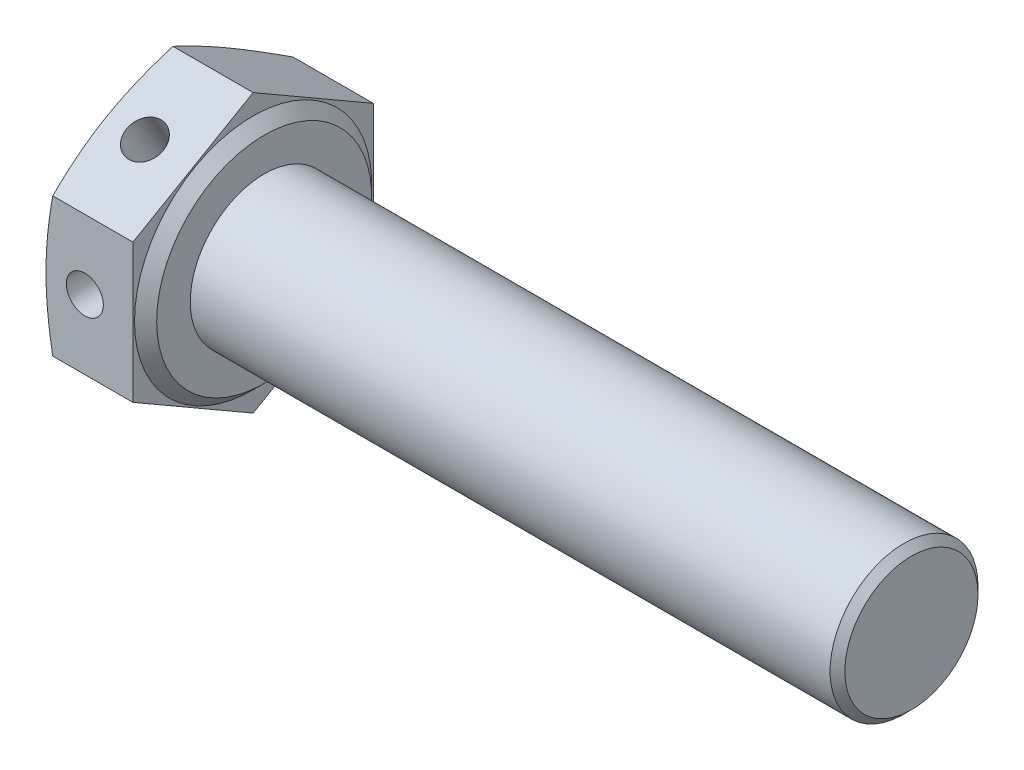
from build123d import *

# Parameters (mm, degrees)
BASEHEAD_DEPTH    = 5.3
SKETCH5_R         = 4
BASEBODY_DEPTH    = 35
CHAMFER1_SIZE     = 0.4
SKETCH6_R         = 1
HOLE_DEPTH        = 42.505100088
CIRPATTERN1_COUNT = 2
CIRPATTERN1_ANGLE = 60


with BuildPart() as part:
    # Sketch2 → BaseHead (new body)
    with BuildSketch(Plane(origin=(0, 0, 0), x_dir=(0, 0, -1), z_dir=(1, 0, 0))):
        Polygon((0, -7.505553499), (6.5, -3.75277675), (6.5, 3.75277675), (0, 7.505553499), (-6.5, 3.75277675), (-6.5, -3.75277675), align=None)
    extrude(amount=BASEHEAD_DEPTH)

    # Sketch3 → BearingFace (revolve, cut)
    with BuildSketch(Plane.XY):
        Polygon((5.3, 7.505553499), (5.3, 5.815), (4.7, 6.415), (4.7, 7.505553499), align=None)
    revolve(axis=Axis((-0.957090588, 0, 0), (1, 0, 0)), mode=Mode.SUBTRACT)

    # Sketch4 → HeadChamfer (revolve, cut)
    with BuildSketch(Plane.XY):
        Polygon((0, 7.505553499), (0.365991543, 7.505553499), (0, 6.5), align=None)
    revolve(axis=Axis((-0.493528746, 0, 0), (1, 0, 0)), mode=Mode.SUBTRACT)

    # Sketch5 → BaseBody (add)
    with BuildSketch(Plane(origin=(5.3, 0, 0), x_dir=(0, 0, -1), z_dir=(1, 0, 0))):
        Circle(SKETCH5_R)
    extrude(amount=BASEBODY_DEPTH)

    # Chamfer1
    chamfer1_edges = [part.edges().sort_by_distance(p)[0] for p in [
        (40.3, 0, 4),
    ]]
    chamfer(chamfer1_edges, length=CHAMFER1_SIZE)

    # Sketch6 → Hole (cut, symmetric)
    with BuildSketch(Plane.XY):
        with Locations((2.1, 0)):
            Circle(SKETCH6_R)
    hole = extrude(amount=HOLE_DEPTH, both=True, mode=Mode.SUBTRACT)

    # CirPattern1: Hole ×2 about axis
    cirpattern1_axis = Axis((40.3, 0, 0), (-1, 0, 0))
    for i in range(1, CIRPATTERN1_COUNT):
        add(hole.rotate(cirpattern1_axis, i * CIRPATTERN1_ANGLE / (CIRPATTERN1_COUNT - 1)), mode=Mode.SUBTRACT)


solid = part.part
